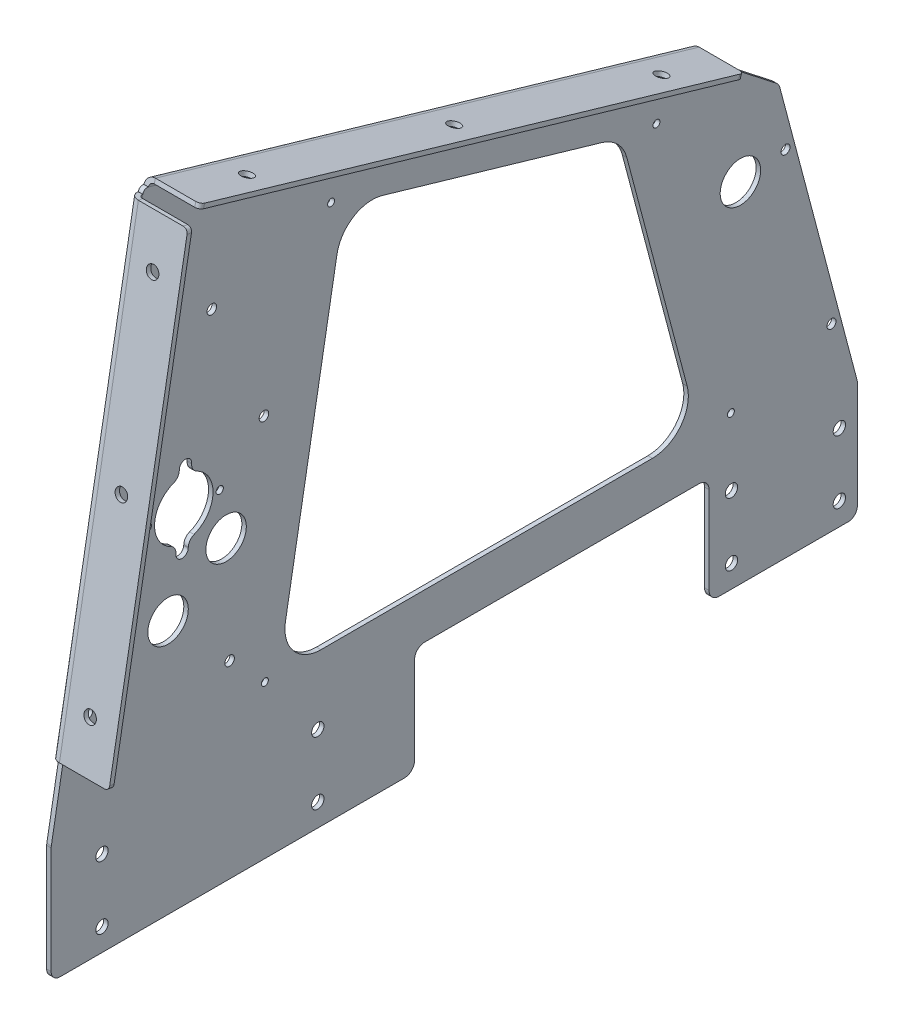
from build123d import *

# Parameters (mm, degrees)
SKETCH1_R                            = 14.2875
SKETCH1_R_2                          = 3.37312
BOSS_EXTRUDE1_DEPTH                  = 3.175
EDGE_FLANGE1_DEPTH                   = 399.923481586
SKETCH5_R                            = 14.2875
SKETCH5_R_2                          = 3.37312
SKETCH5_R_3                          = 2.5527
SKETCH5_R_4                          = 3.3734375
CUT_EXTRUDE1_DEPTH                   = 612.935699735
EDGE_FLANGE2_DEPTH                   = 371.853711622
F_11_32_0_34375_DIAMETER_HOLE3_D     = 8.73125
F_1_4_0_25_DIAMETER_HOLE1_D          = 6.35
F_17_64_0_26563_DIAMETER_HOLE2_D     = 6.747002
F_11_32_0_34375_DIAMETER_HOLE1_D     = 8.73125
F_11_32_0_34375_DIAMETER_HOLE2_D     = 8.73125
F_11_32_0_34375_DIAMETER_HOLE2_DEPTH = 3.175
F_10_0_1935_DIAMETER_HOLE1_D         = 4.9149
CUT_EXTRUDE2_START                   = -50.8
CUT_EXTRUDE2_DEPTH                   = 50.8
FILLET1_R                            = 3.175


# Sheet-metal steps are written as plain solids
with BuildPart() as part:
    # Sketch1 → Boss-Extrude1 (new body)
    with BuildSketch(Plane(origin=(0, 0, 0), x_dir=(0, 0, -1), z_dir=(1, 0, 0))):
        with BuildLine():
            Line((397.810445414, 0), (306.604125414, 0))
            ThreePointArc((306.604125414, 0), (301.552731346, 2.092355932), (299.460375414, 7.14375))
            Line((299.460375414, 7.14375), (299.460375414, 68.80225))
            ThreePointArc((299.460375414, 68.80225), (297.368019482, 73.853644068), (292.316625414, 75.946))
            Line((292.316625414, 75.946), (98.641625414, 75.946))
            ThreePointArc((98.641625414, 75.946), (93.590231346, 73.853644068), (91.497875414, 68.80225))
            Line((91.497875414, 68.80225), (91.497875414, 7.14375))
            ThreePointArc((91.497875414, 7.14375), (89.405519482, 2.092355932), (84.354125414, 0))
            Line((84.354125414, 0), (-158.75, 0))
            ThreePointArc((-158.75, 0), (-163.240128061, 1.859871939), (-165.1, 6.35))
            Line((-165.1, 6.35), (-165.1, 81.994446987))
            ThreePointArc((-165.1, 81.994446987), (-165.075836333, 82.547885953), (-165.003529232, 83.097112915))
            Line((-165.003529232, 83.097112915), (-100.43180985, 449.301531106))
            ThreePointArc((-100.43180985, 449.301531106), (-98.981933252, 451.446245541), (-96.4172045, 451.798536022))
            Line((-96.4172045, 451.798536022), (287.551897257, 339.965982534))
            Line((287.551897257, 339.965982534), (347.134178996, 293.415202216))
            ThreePointArc((347.134178996, 293.415202216), (348.525632464, 291.907463008), (349.363704269, 290.034749489))
            Line((349.363704269, 290.034749489), (403.949421055, 83.617862545))
            ThreePointArc((403.949421055, 83.617862545), (404.107468334, 82.812983692), (404.160445414, 81.994446987))
            Line((404.160445414, 81.994446987), (404.160445414, 6.35))
            ThreePointArc((404.160445414, 6.35), (402.300573474, 1.859871939), (397.810445414, 0))
        make_face()
        with Locations((-82.55, 179.578)):
            Circle(SKETCH1_R, mode=Mode.SUBTRACT)
        with Locations((-51.675354011, 354.676818486)):
            Circle(SKETCH1_R_2, mode=Mode.SUBTRACT)
        with Locations((321.610445414, 245.95582)):
            Circle(SKETCH1_R, mode=Mode.SUBTRACT)
        with BuildLine():
            Line((25.362018074, 107.95), (259.432488996, 107.95))
            ThreePointArc((259.432488996, 107.95), (279.55833085, 117.854500987), (283.988391562, 139.843662232))
            Line((283.988391562, 139.843662232), (241.393515847, 300.916964234))
            ThreePointArc((241.393515847, 300.916964234), (235.020226293, 312.158932355), (223.940339151, 318.810005043))
            Line((223.940339151, 318.810005043), (68.8320461, 363.985922583))
            ThreePointArc((68.8320461, 363.985922583), (48.314216085, 361.16759873), (36.715203303, 344.009883255))
            Line((36.715203303, 344.009883255), (0.347901148, 137.760663713))
            ThreePointArc((0.347901148, 137.760663713), (5.904489219, 117.023194714), (25.362018074, 107.95))
        make_face(mode=Mode.SUBTRACT)
    extrude(amount=-BOSS_EXTRUDE1_DEPTH)

    # Edge-Flange1 section (across the edge) → Edge-Flange1 (add)
    with BuildSketch(Plane(origin=(0, 343.014320414, -288.439737991), x_dir=(3.4914813388431334e-15, -0.9601064189437505, 0.27963487676434007), z_dir=(0, 0.27963487676434007, 0.9601064189437505))):
        with BuildLine():
            Line((-3.175, 3.175), (-3.175, 34.925))
            Line((-3.175, 34.925), (0, 34.925))
            Line((0, 34.925), (0, 3.175))
            ThreePointArc((0, 3.175), (0.92993597, 0.92993597), (3.175, 0))
            Line((3.175, 0), (3.175, -3.175))
            ThreePointArc((3.175, -3.175), (-1.315128061, -1.315128061), (-3.175, 3.175))
        make_face()
    extrude(amount=EDGE_FLANGE1_DEPTH)

    # Sketch5 → Cut-Extrude1 (cut, through all)
    with BuildSketch(Plane.ZY.offset(3.175)):
        with Locations(Location((82.55, 179.578, 0), (0, 0, 180))):
            Circle(SKETCH5_R)
        with Locations(Location((51.675354011, 354.676818486, 0), (0, 0, 180))):
            Circle(SKETCH5_R_2)
        with Locations(Location((-321.610445414, 245.95582, 0), (0, 0, 180))):
            Circle(SKETCH5_R)
        with Locations((96.823649998, 243.734949129)):
            Circle(SKETCH5_R_3)
        with Locations((46.08261916, 241.287953106)):
            Circle(SKETCH5_R_3)
        with Locations((41.572725009, 209.603038456)):
            Circle(SKETCH5_R)
        with Locations((114.900475932, 288.654874532)):
            Circle(SKETCH5_R_4)
        with Locations((14.844008226, 271.012219681)):
            Circle(SKETCH5_R_4)
        with Locations((39.102658646, 133.434576585)):
            Circle(SKETCH5_R_4)
        with Locations((139.159126352, 151.077231436)):
            Circle(SKETCH5_R_4)
        with BuildLine():
            Line((65.865907916, 267.671524878), (65.896371611, 267.039828185))
            ThreePointArc((65.896371611, 267.039828185), (65.022940965, 263.507443035), (62.353599656, 261.034541314))
            ThreePointArc((62.353599656, 261.034541314), (50.839590801, 241.517358984), (64.178240374, 223.19870091))
            ThreePointArc((64.178240374, 223.19870091), (67.073153395, 220.994136431), (68.282440243, 217.562190734))
            Line((68.282440243, 217.562190734), (68.312903938, 216.930494041))
            ThreePointArc((68.312903938, 216.930494041), (72.887074248, 212.777207047), (77.040361242, 217.351377357))
            Line((77.040361242, 217.351377357), (77.009897547, 217.98307405))
            ThreePointArc((77.009897547, 217.98307405), (77.883328193, 221.5154592), (80.552669502, 223.988360921))
            ThreePointArc((80.552669502, 223.988360921), (92.066678357, 243.505543251), (78.728028784, 261.824201325))
            ThreePointArc((78.728028784, 261.824201325), (75.833115763, 264.028765804), (74.623828915, 267.460711501))
            Line((74.623828915, 267.460711501), (74.59336522, 268.092408194))
            ThreePointArc((74.59336522, 268.092408194), (70.01919491, 272.245695188), (65.865907916, 267.671524878))
        make_face()
    extrude(amount=-CUT_EXTRUDE1_DEPTH, mode=Mode.SUBTRACT)

    # Edge-Flange2 section (across the edge) → Edge-Flange2 (add)
    with BuildSketch(Plane(origin=(0, 449.85286407, 103.558574466), x_dir=(3.4914813388431334e-15, -0.17364817766692356, -0.9848077530122094), z_dir=(0, -0.9848077530122094, 0.17364817766692356))):
        with BuildLine():
            Line((-3.175, 3.175), (-3.175, 38.1))
            Line((-3.175, 38.1), (0, 38.1))
            Line((0, 38.1), (0, 3.175))
            ThreePointArc((0, 3.175), (0.92993597, 0.92993597), (3.175, 0))
            Line((3.175, 0), (3.175, -3.175))
            ThreePointArc((3.175, -3.175), (-1.315128061, -1.315128061), (-3.175, 3.175))
        make_face()
    extrude(amount=EDGE_FLANGE2_DEPTH)

    # 11/32 (0.34375) Diameter Hole3 (through all)
    with Locations(Plane(origin=(0, 0, 0), x_dir=(0, 0, -1), z_dir=(1, 0, 0))):
        with Locations((-129.221774586, 15.875), (-129.221774586, 60.325), (23.178225414, 15.875), (23.178225414, 60.325), (315.278225414, 60.325), (315.278225414, 15.875), (391.478225414, 15.875), (391.478225414, 60.325)):
            Hole(F_11_32_0_34375_DIAMETER_HOLE3_D / 2)

    # 1/4 (0.25) Diameter Hole1 (through all)
    with Locations(Plane(origin=(0, 0, 0), x_dir=(0, 0, -1), z_dir=(1, 0, 0))):
        with Locations((353.440683712, 249.779512828), (385.908994874, 127)):
            Hole(F_1_4_0_25_DIAMETER_HOLE1_D / 2)

    # 17/64 (0.26563) Diameter Hole2 (through all)
    with Locations(Plane.ZY.offset(3.175)):
        with Locations((-293.708669355, 320.539904842)):
            Hole(F_17_64_0_26563_DIAMETER_HOLE2_D / 2)

    # 11/32 (0.34375) Diameter Hole1 (through all)
    with Locations(Plane(origin=(0, 396.680507326, -115.53480176), x_dir=(1, 0, 0), z_dir=(-3.629989339958336e-15, 0.9601064189437505, -0.27963487676434007))):
        with Locations((19.05, 136.69059512), (19.05, -15.70940488), (19.05, -168.10940488)):
            Hole(F_11_32_0_34375_DIAMETER_HOLE1_D / 2)

    # 11/32 (0.34375) Diameter Hole2
    with Locations(Plane(origin=(0, 31.825615837, 180.492036493), x_dir=(1, 0, 0), z_dir=(-3.2076224383382817e-15, 0.17364817766692356, 0.9848077530122092))):
        with Locations((19.05, 391.508974703), (19.05, 264.508974703), (19.05, 137.508974703)):
            Hole(F_11_32_0_34375_DIAMETER_HOLE2_D / 2, depth=F_11_32_0_34375_DIAMETER_HOLE2_DEPTH)

    # #10 (0.1935) Diameter Hole1 (through all)
    with Locations(Plane.ZY.offset(3.175)):
        with Locations((-262.310998074, 311.15), (-314.845818074, 107.95), (14.185781926, 107.95), (-32.555298074, 377.825)):
            Hole(F_10_0_1935_DIAMETER_HOLE1_D / 2)

    # Sketch31 → Cut-Extrude2 (cut)
    with BuildSketch(Plane(origin=(0, 52.374163006, -9.23497803), x_dir=(1, 0, 0), z_dir=(-2.784783301719586e-15, -0.9848077530122092, 0.1736481776669235)).offset(CUT_EXTRUDE2_START)):
        with BuildLine():
            Line((3.175, 180.101417089), (38.1, 180.101417089))
            Line((38.1, 180.101417089), (38.1, 183.276417089))
            Line((38.1, 183.276417089), (3.175, 183.276417089))
            ThreePointArc((3.175, 183.276417089), (-1.315128061, 181.416545149), (-3.175, 176.926417089))
            Line((-3.175, 176.926417089), (0, 176.926417089))
            ThreePointArc((0, 176.926417089), (0.92993597, 179.171481119), (3.175, 180.101417089))
        make_face()
    extrude(amount=CUT_EXTRUDE2_DEPTH, mode=Mode.SUBTRACT)

    # Fillet1
    fillet1_edges = [part.edges().sort_by_distance(p)[0] for p in [
        (38.1, 450.128530552, 105.121956774),
        (38.1, 133.952346214, 160.87234873),
        (34.925, 344.538489354, -288.883658358),
        (34.925, 456.371042842, 95.0854434),
    ]]
    fillet(fillet1_edges, radius=FILLET1_R)


solid = part.part
